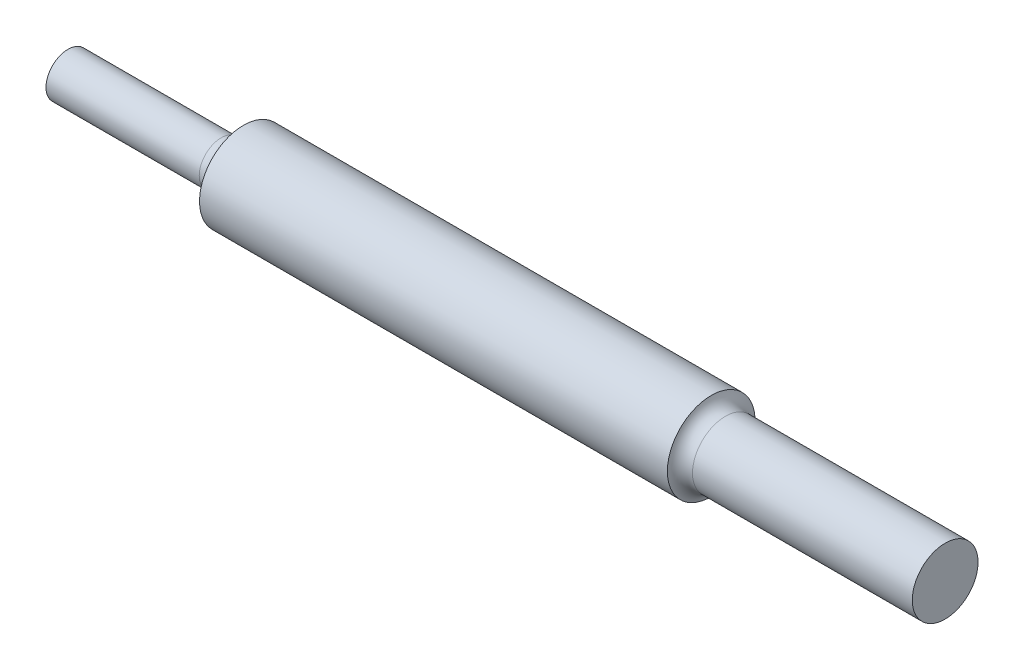
from build123d import *

# Parameters (mm, degrees)
FILLET1_R = 9.652
FILLET2_R = 6.35


with BuildPart() as part:
    # Sketch1 → Revolve3 (revolve)
    with BuildSketch(Plane.XY, mode=Mode.PRIVATE) as revolve3_sk:
        Polygon((-101.6, 19.05), (101.6, 19.05), (101.6, 14.2875), (203.2, 14.2875), (203.2, 0), (-177.8, 0), (-177.8, 9.525), (-101.6, 9.525), align=None)
    revolve(revolve3_sk.sketch.rotate(Axis((-177.8, 0, 0), (1, 0, 0)), 90), axis=Axis((-177.8, 0, 0), (1, 0, 0)))

    # Fillet1
    # the kernel refuses this fillet: 9.652 mm, written as the material it adds along each edge
    with BuildSketch(Plane(origin=(-101.6, 0, 0), x_dir=(0, 0, 1), z_dir=(0, 1, 0))) as fillet1_piece_1_section:
        with BuildLine():
            CenterArc((9.525 + FILLET1_R, -FILLET1_R), FILLET1_R, 90, 90)
            Line((9.525 + FILLET1_R, 0), (9.525, 0))
            Line((9.525, 0), (9.525, -FILLET1_R))
        make_face()
    fillet1_piece_1 = revolve(axis=Axis((-101.6, 0, 0), (1, 0, 0)), mode=Mode.PRIVATE)
    fillet1_piece_1 = fillet1_piece_1 & Plane(origin=(-104.387487572, 0, 0), x_dir=(0, 0, 1), z_dir=(1, 0, 0)) * Cylinder(19.05, 77, mode=Mode.PRIVATE)
    add(fillet1_piece_1)

    # Fillet2
    # the kernel refuses this fillet: 6.35 mm, written as the material it adds along each edge
    with BuildSketch(Plane(origin=(101.6, 0, 0), x_dir=(0, 0, 1), z_dir=(0, 1, 0))) as fillet2_piece_1:
        with BuildLine():
            CenterArc((20.6375, 6.148361062), FILLET2_R, 180, 75.522487814)
            Line((14.2875, 6.148361062), (14.1605, 6.148361062))
            Line((14.1605, 6.148361062), (14.1605, 0))
            Line((14.1605, 0), (14.2875, -0.127))
            ThreePointArc((14.2875, -0.127), (16.66875, -0.127), (19.01825, -0.122967221))
            Line((19.01825, -0.122967221), (19.05, 0))
        make_face()
    revolve(axis=Axis((101.6, 0, 0), (1, 0, 0)))


solid = part.part
